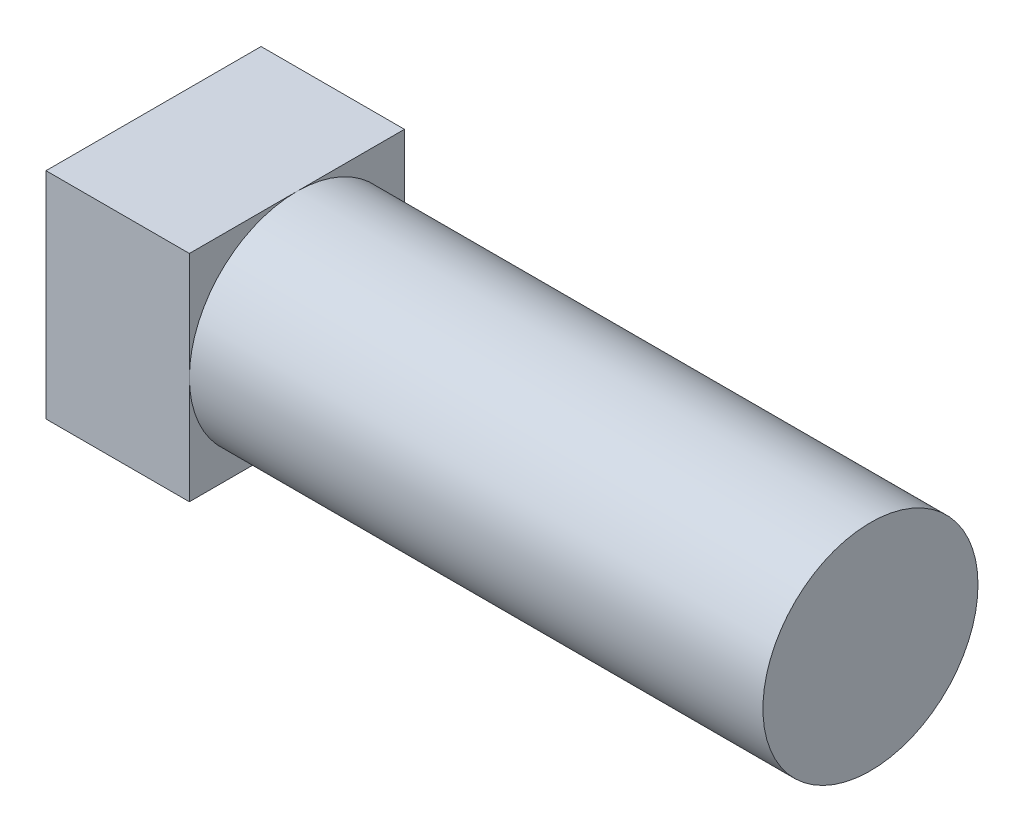
from build123d import *

# Parameters (mm, degrees)
SKETCH1_W           = 15
SKETCH1_H           = 15
BOSS_EXTRUDE1_DEPTH = 10
SKETCH2_R           = 7.5
BOSS_EXTRUDE2_DEPTH = 40


with BuildPart() as part:
    # Sketch1 → Boss-Extrude1 (new body)
    with BuildSketch(Plane(origin=(0, 0, 0), x_dir=(0, 0, -1), z_dir=(1, 0, 0))):
        Rectangle(SKETCH1_W, SKETCH1_H)
    extrude(amount=BOSS_EXTRUDE1_DEPTH)

    # Sketch2 → Boss-Extrude2 (add)
    with BuildSketch(Plane(origin=(10, 0, 0), x_dir=(0, 0, -1), z_dir=(1, 0, 0))):
        Circle(SKETCH2_R)
    extrude(amount=BOSS_EXTRUDE2_DEPTH)


solid = part.part
